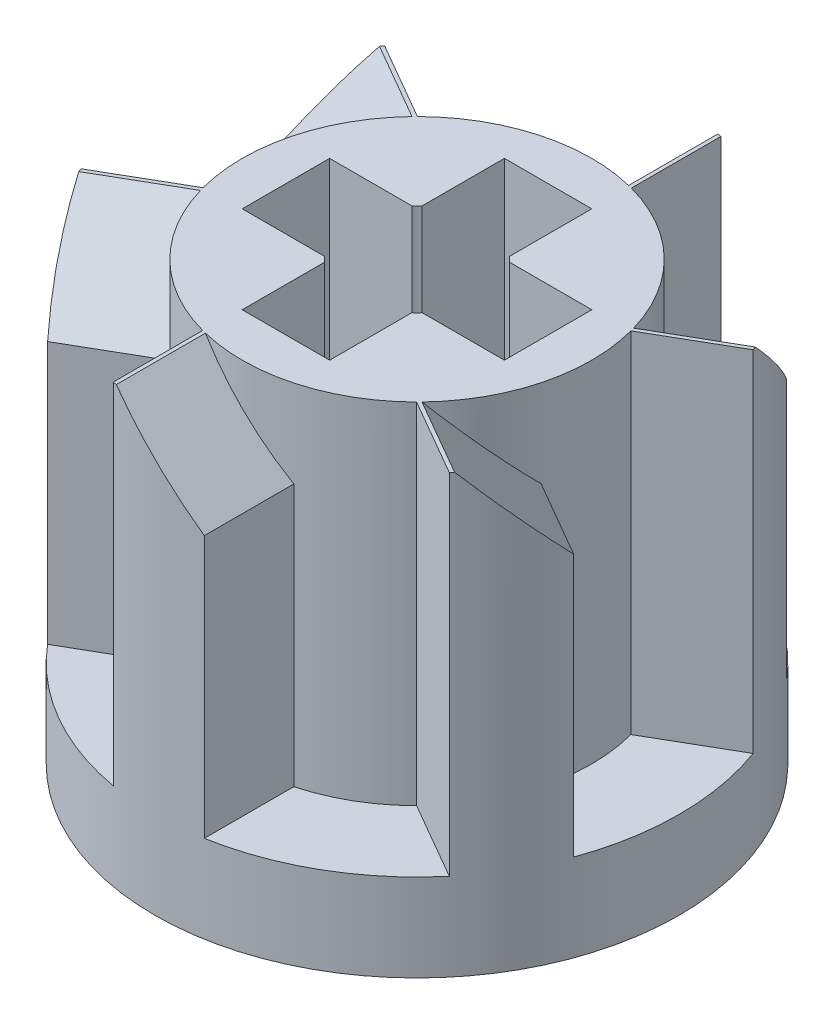
from build123d import *

# Parameters (mm, degrees)
SKETCH1_R           = 6
BOSS_EXTRUDE1_DEPTH = 2
SKETCH2_R           = 4
BOSS_EXTRUDE2_DEPTH = 8
SKETCH3_W           = 6
SKETCH3_H           = 2
CUT_EXTRUDE1_DEPTH  = 14.114877049
SKETCH4_W           = 2
SKETCH4_H           = 6
CUT_EXTRUDE2_DEPTH  = 8
SKETCH10_R          = 1.5
CUT_EXTRUDE3_DEPTH  = 14.114877049
BOSS_EXTRUDE3_START = -8
BOSS_EXTRUDE3_DEPTH = 8
CHAMFER3_SIZE       = 2


with BuildPart() as part:
    # Sketch1 → Boss-Extrude1 (new body)
    with BuildSketch(Plane(origin=(0, 0, 0), x_dir=(1, 0, 0), z_dir=(0, 1, 0))):
        with Locations(Location((0, 0, 0), (0, 0, 270))):
            Circle(SKETCH1_R)
    extrude(amount=BOSS_EXTRUDE1_DEPTH)

    # Sketch2 → Boss-Extrude2 (add)
    with BuildSketch(Plane(origin=(0, 2, 0), x_dir=(1, 0, 0), z_dir=(0, 1, 0))):
        with Locations(Location((0, 0, 0), (0, 0, 270))):
            Circle(SKETCH2_R)
    extrude(amount=BOSS_EXTRUDE2_DEPTH)

    # Sketch3 → Cut-Extrude1 (cut, through all)
    with BuildSketch(Plane(origin=(0, 10, 0), x_dir=(1, 0, 0), z_dir=(0, 1, 0))):
        Rectangle(SKETCH3_W, SKETCH3_H)
    extrude(amount=-CUT_EXTRUDE1_DEPTH, mode=Mode.SUBTRACT)

    # Sketch4 → Cut-Extrude2 (cut)
    with BuildSketch(Plane(origin=(0, 10, 0), x_dir=(1, 0, 0), z_dir=(0, 1, 0))):
        Rectangle(SKETCH4_W, SKETCH4_H)
    extrude(amount=-CUT_EXTRUDE2_DEPTH, mode=Mode.SUBTRACT)

    # Sketch10 → Cut-Extrude3 (cut, through all)
    with BuildSketch(Plane(origin=(0, 10, 0), x_dir=(1, 0, 0), z_dir=(0, 1, 0))):
        Circle(SKETCH10_R)
    extrude(amount=-CUT_EXTRUDE3_DEPTH, mode=Mode.SUBTRACT)

    # Sketch11 → Boss-Extrude3 (add)
    with BuildSketch(Plane(origin=(0, 10, 0), x_dir=(1, 0, 0), z_dir=(0, 1, 0)).offset(BOSS_EXTRUDE3_START)):
        with BuildLine():
            Line((-1.041889066, 5.908846518), (-1.042680136, 3.861711814))
            Line((-1.042680136, 3.861711814), (1.041889066, 3.86192532))
            Line((1.041889066, 3.86192532), (1.041889066, 5.908846518))
            ThreePointArc((1.041889066, 5.908846518), (0, 6), (-1.041889066, 5.908846518))
        make_face()
        with BuildLine():
            Line((4.596266659, 3.856725658), (2.823000465, 2.833843393))
            Line((2.823000465, 2.833843393), (3.865469967, 1.028660261))
            Line((3.865469967, 1.028660261), (5.638155725, 2.05212086))
            ThreePointArc((5.638155725, 2.05212086), (5.196152423, 3), (4.596266659, 3.856725658))
        make_face()
        with BuildLine():
            Line((5.638155725, -2.05212086), (3.865680601, -1.027868421))
            Line((3.865680601, -1.027868421), (2.823580901, -2.833265059))
            Line((2.823580901, -2.833265059), (4.596266659, -3.856725658))
            ThreePointArc((4.596266659, -3.856725658), (5.196152423, -3), (5.638155725, -2.05212086))
        make_face()
        with BuildLine():
            Line((1.041889066, -5.908846518), (1.042680136, -3.861711814))
            Line((1.042680136, -3.861711814), (-1.041889066, -3.86192532))
            Line((-1.041889066, -3.86192532), (-1.041889066, -5.908846518))
            ThreePointArc((-1.041889066, -5.908846518), (0, -6), (1.041889066, -5.908846518))
        make_face()
        with BuildLine():
            Line((-4.596266659, -3.856725658), (-2.823000465, -2.833843393))
            Line((-2.823000465, -2.833843393), (-3.865469967, -1.028660261))
            Line((-3.865469967, -1.028660261), (-5.638155725, -2.05212086))
            ThreePointArc((-5.638155725, -2.05212086), (-5.196152423, -3), (-4.596266659, -3.856725658))
        make_face()
        with BuildLine():
            Line((-5.638155725, 2.05212086), (-3.865680601, 1.027868421))
            Line((-3.865680601, 1.027868421), (-2.823580901, 2.833265059))
            Line((-2.823580901, 2.833265059), (-4.596266659, 3.856725658))
            ThreePointArc((-4.596266659, 3.856725658), (-5.196152423, 3), (-5.638155725, 2.05212086))
        make_face()
    extrude(amount=BOSS_EXTRUDE3_DEPTH)

    # Chamfer3
    # the kernel refuses this chamfer: 2 mm, written as the material it takes off along each edge
    with BuildSketch(Plane(origin=(9.051545693, 10, -6.426687193), x_dir=(0.49947639120581244, 0.02749587661058648, 0.865891050535478), z_dir=(-0.8662185531215343, 0, 0.49966530620810146))) as chamfer3_piece_1_section:
        Polygon((CHAMFER3_SIZE * 0.999621916911, -CHAMFER3_SIZE * 0.0274958766106), (-CHAMFER3_SIZE * 0.0274958766106, -CHAMFER3_SIZE * 0.999621916911), (0, 0), align=None)
    chamfer3_piece_1 = extrude(amount=12.333866809, mode=Mode.PRIVATE)
    chamfer3_piece_1 = chamfer3_piece_1 - Plane(origin=(0, 9.335728608, 0), x_dir=(0, 0, 1), z_dir=(0, -1, 0)) * Cylinder(4, 33, mode=Mode.PRIVATE)
    add(chamfer3_piece_1, mode=Mode.SUBTRACT)
    with BuildSketch(Plane(origin=(10.091447218, 10, 4.625524917), x_dir=(-0.5001454510704151, 0.027495876610586487, 0.8655047686425457), z_dir=(-0.8658321251267121, 0, -0.5003346191286003))) as chamfer3_piece_2_section:
        Polygon((CHAMFER3_SIZE * 0.999621916911, -CHAMFER3_SIZE * 0.0274958766106), (-CHAMFER3_SIZE * 0.0274958766106, -CHAMFER3_SIZE * 0.999621916911), (0, 0), align=None)
    chamfer3_piece_2 = extrude(amount=12.333866809, mode=Mode.PRIVATE)
    chamfer3_piece_2 = chamfer3_piece_2 - Plane(origin=(0, 9.332082239, 0), x_dir=(0, 0, 1), z_dir=(0, -1, 0)) * Cylinder(4, 33, mode=Mode.PRIVATE)
    add(chamfer3_piece_2, mode=Mode.SUBTRACT)
    with BuildSketch(Plane(origin=(1.039901525, 10, 11.05221211), x_dir=(0.027495874557653455, -0.9996219169112968, 1.0625176464596534e-05), z_dir=(0.0003864279948254377, 0, -0.9999999253366997))) as chamfer3_piece_3_section:
        Polygon((CHAMFER3_SIZE * 0.999621916911, CHAMFER3_SIZE * 0.0274958766106), (-CHAMFER3_SIZE * 0.0274958766106, CHAMFER3_SIZE * 0.999621916911), (0, 0), align=None)
    chamfer3_piece_3 = extrude(amount=12.333866809, mode=Mode.PRIVATE)
    chamfer3_piece_3 = chamfer3_piece_3 - Plane(origin=(0, 9.010529582, 0), x_dir=(0, 0, 1), z_dir=(0, -1, 0)) * Cylinder(4, 33, mode=Mode.PRIVATE)
    add(chamfer3_piece_3, mode=Mode.SUBTRACT)
    with BuildSketch(Plane(origin=(-9.051545693, 10, 6.426687193), x_dir=(-0.4994763912058064, 0.02749587661058648, -0.8658910505354813), z_dir=(0.8662185531215377, 0, -0.4996653062080955))) as chamfer3_piece_4_section:
        Polygon((CHAMFER3_SIZE * 0.999621916911, -CHAMFER3_SIZE * 0.0274958766106), (-CHAMFER3_SIZE * 0.0274958766106, -CHAMFER3_SIZE * 0.999621916911), (0, 0), align=None)
    chamfer3_piece_4 = extrude(amount=12.333866809, mode=Mode.PRIVATE)
    chamfer3_piece_4 = chamfer3_piece_4 - Plane(origin=(0, 9.335728608, 0), x_dir=(0, 0, 1), z_dir=(0, -1, 0)) * Cylinder(4, 33, mode=Mode.PRIVATE)
    add(chamfer3_piece_4, mode=Mode.SUBTRACT)
    with BuildSketch(Plane(origin=(-10.091447218, 10, -4.625524917), x_dir=(0.5001454510704163, 0.02749587661058648, -0.8655047686425448), z_dir=(0.8658321251267114, 0, 0.5003346191286018))) as chamfer3_piece_5_section:
        Polygon((CHAMFER3_SIZE * 0.999621916911, -CHAMFER3_SIZE * 0.0274958766106), (-CHAMFER3_SIZE * 0.0274958766106, -CHAMFER3_SIZE * 0.999621916911), (0, 0), align=None)
    chamfer3_piece_5 = extrude(amount=12.333866809, mode=Mode.PRIVATE)
    chamfer3_piece_5 = chamfer3_piece_5 - Plane(origin=(0, 9.332082239, 0), x_dir=(0, 0, 1), z_dir=(0, -1, 0)) * Cylinder(4, 33, mode=Mode.PRIVATE)
    add(chamfer3_piece_5, mode=Mode.SUBTRACT)
    with BuildSketch(Plane(origin=(-1.039901525, 10, -11.05221211), x_dir=(0.9996218422762253, 0.027495876610586487, 0.00038628189292865347), z_dir=(-0.00038642799481849587, 0, 0.9999999253366997))) as chamfer3_piece_6_section:
        Polygon((CHAMFER3_SIZE * 0.999621916911, -CHAMFER3_SIZE * 0.0274958766106), (-CHAMFER3_SIZE * 0.0274958766106, -CHAMFER3_SIZE * 0.999621916911), (0, 0), align=None)
    chamfer3_piece_6 = extrude(amount=12.333866809, mode=Mode.PRIVATE)
    chamfer3_piece_6 = chamfer3_piece_6 - Plane(origin=(0, 9.346435038, 0), x_dir=(0, 0, 1), z_dir=(0, -1, 0)) * Cylinder(4, 33, mode=Mode.PRIVATE)
    add(chamfer3_piece_6, mode=Mode.SUBTRACT)


solid = part.part
